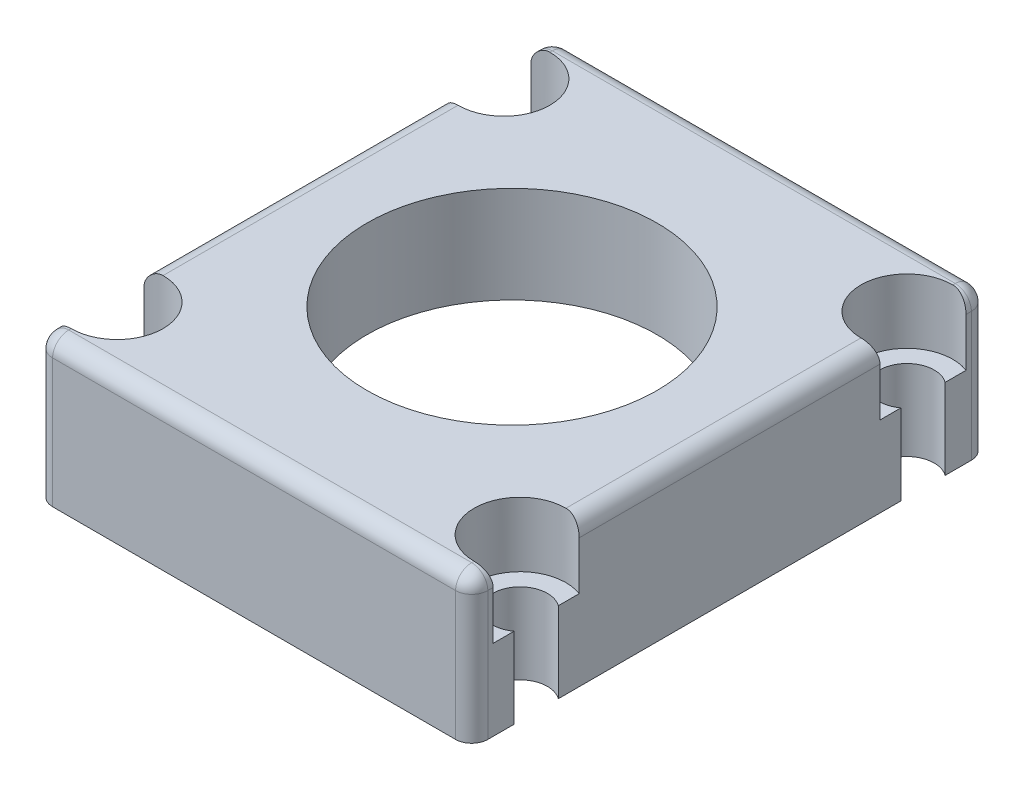
from build123d import *

# Parameters (mm, degrees)
SKETCH2_W               = 27
SKETCH2_H               = 32
SKETCH2_R               = 9
BOSS_EXTRUDE1_DEPTH     = 6
SKETCH3_W               = 27
SKETCH3_H               = 32
SKETCH3_W_2             = 25
SKETCH3_H_2             = 30
BOSS_EXTRUDE2_DEPTH     = 3
CUT_EXTRUDE1_DEPTH      = 22.77728174
CUT_EXTRUDE1_DEPTH_BACK = 22.77728174
SKETCH1_R               = 1.7
BOSS_EXTRUDE4_REACH     = 24.787
MIRROR2_COPY_1_REACH    = 24.787
SKETCH6_R               = 2.85
CUT_EXTRUDE2_DEPTH      = 4
MIRROR4_COPY_1_SKETCH_R = 2.85
MIRROR4_COPY_1_DEPTH    = 4
FILLET1_R               = 1
FILLET4_R               = 1


with BuildPart() as part:
    # Sketch2 → Boss-Extrude1 (new body)
    with BuildSketch(Plane(origin=(0, 0, 0), x_dir=(1, 0, 0), z_dir=(0, 1, 0))):
        Rectangle(SKETCH2_W, SKETCH2_H)
        with Locations(Location((0, 0, 0), (0, 0, 270))):
            Circle(SKETCH2_R, mode=Mode.SUBTRACT)
    extrude(amount=BOSS_EXTRUDE1_DEPTH)

    # Sketch3 → Boss-Extrude2 (add)
    with BuildSketch(Plane.XZ):
        Rectangle(SKETCH3_W, SKETCH3_H)
        Rectangle(SKETCH3_W_2, SKETCH3_H_2, mode=Mode.SUBTRACT)
    extrude(amount=BOSS_EXTRUDE2_DEPTH)

    # Sketch1 → Cut-Extrude1 (cut, two sides: drawn at the far end of the back side and taken through both)
    with BuildSketch(Plane(origin=(0, 0, 0), x_dir=(1, 0, 0), z_dir=(0, 1, 0)).offset(-CUT_EXTRUDE1_DEPTH_BACK)):
        with Locations((-12.5, 12)):
            Circle(SKETCH1_R)
        with Locations((12.5, 12)):
            Circle(SKETCH1_R)
        with Locations((-12.5, -12)):
            Circle(SKETCH1_R)
        with Locations((12.5, -12)):
            Circle(SKETCH1_R)
    extrude(amount=CUT_EXTRUDE1_DEPTH + CUT_EXTRUDE1_DEPTH_BACK, mode=Mode.SUBTRACT)

    # Sketch5 → Boss-Extrude4 (add, up to next)
    with BuildSketch(Plane.XZ.offset(3), mode=Mode.PRIVATE) as boss_extrude4_sk1:
        with BuildLine():
            Line((13.5, -10.625227292), (13.5, -9.708712153))
            ThreePointArc((13.5, -9.708712153), (10, -12), (13.5, -14.291287847))
            Line((13.5, -14.291287847), (13.5, -13.374772708))
            ThreePointArc((13.5, -13.374772708), (10.8, -12), (13.5, -10.625227292))
        make_face()
    boss_extrude4_tool1 = extrude(boss_extrude4_sk1.sketch, amount=-BOSS_EXTRUDE4_REACH, mode=Mode.PRIVATE) - part.part
    boss_extrude4 = boss_extrude4_tool1.solids().sort_by_distance((13.438967, -3, -10.16697))[0]
    add(boss_extrude4)

    # Mirror1: Boss-Extrude4 across plane
    add(boss_extrude4.mirror(Plane(origin=(0, 0, 0), x_dir=(0, 0, 1), z_dir=(1, 0, 0))))

    # Mirror2: Boss-Extrude4 across plane
    add(boss_extrude4.mirror(Plane.XY))

    # Mirror2 copy 1 sketch → Mirror2 copy 1 (add, up to next)
    with BuildSketch(Plane(origin=(0, -3, 0), x_dir=(-1, 0, 0), z_dir=(0, -1, 0)), mode=Mode.PRIVATE) as mirror2_copy_1_sk1:
        with BuildLine():
            Line((13.5, -10.625227292), (13.5, -9.708712153))
            ThreePointArc((13.5, -9.708712153), (10, -12), (13.5, -14.291287847))
            Line((13.5, -14.291287847), (13.5, -13.374772708))
            ThreePointArc((13.5, -13.374772708), (10.8, -12), (13.5, -10.625227292))
        make_face()
    mirror2_copy_1_tool1 = extrude(mirror2_copy_1_sk1.sketch, amount=-MIRROR2_COPY_1_REACH, mode=Mode.PRIVATE) - part.part
    add(mirror2_copy_1_tool1.solids().sort_by_distance((-13.438967, -3, 10.16697))[0])

    # Sketch6 → Cut-Extrude2 (cut)
    with BuildSketch(Plane(origin=(0, 6, 0), x_dir=(1, 0, 0), z_dir=(0, 1, 0))):
        with Locations((12.5, 12)):
            Circle(SKETCH6_R)
    cut_extrude2 = extrude(amount=-CUT_EXTRUDE2_DEPTH, mode=Mode.SUBTRACT)

    # Mirror3: Cut-Extrude2 across plane
    add(cut_extrude2.mirror(Plane(origin=(0, 0, 0), x_dir=(0, 0, 1), z_dir=(1, 0, 0))), mode=Mode.SUBTRACT)

    # Mirror4: Cut-Extrude2 across plane
    add(cut_extrude2.mirror(Plane.XY), mode=Mode.SUBTRACT)

    # Mirror4 copy 1 sketch → Mirror4 copy 1 (cut)
    with BuildSketch(Plane(origin=(0, 6, 0), x_dir=(-1, 0, 0), z_dir=(0, 1, 0))):
        with Locations((12.5, 12)):
            Circle(MIRROR4_COPY_1_SKETCH_R)
    extrude(amount=-MIRROR4_COPY_1_DEPTH, mode=Mode.SUBTRACT)

    # Fillet1
    fillet1_edges = [part.edges().sort_by_distance(p)[0] for p in [
        (-13.5, 6, -15.334400615),
        (13.5, 6, -15.334400615),
        (0, 6, 16),
        (-13.5, 6, 0),
        (13.5, 6, 0),
        (-13.5, 6, 15.334400615),
        (13.5, 6, 15.334400615),
        (0, 6, -16),
    ]]
    fillet(fillet1_edges, radius=FILLET1_R)

    # Fillet4
    # the kernel refuses this fillet: 1 mm, written as the material it takes off along each edge
    with BuildSketch(Plane(origin=(-12.5, 5, -15), x_dir=(0, 0, -1), z_dir=(-1, 0, 0))) as fillet4_piece_1_section:
        Polygon((0, 0), (FILLET4_R, 0), (FILLET4_R, -FILLET4_R), (0, -FILLET4_R), align=None)
    fillet4_piece_1 = extrude(amount=FILLET4_R, mode=Mode.PRIVATE)
    fillet4_piece_1 = fillet4_piece_1 - Plane(origin=(-12.5, 5, -15), x_dir=(0, -0.7071067811865475, 0.7071067811865475), z_dir=(-1, 0, 0)) * Sphere(FILLET4_R, mode=Mode.PRIVATE)
    add(fillet4_piece_1, mode=Mode.SUBTRACT)
    with BuildSketch(Plane(origin=(12.5, 5, -15), x_dir=(1, 0, 0), z_dir=(0, 0, -1))) as fillet4_piece_2_section:
        Polygon((0, 0), (FILLET4_R, 0), (FILLET4_R, -FILLET4_R), (0, -FILLET4_R), align=None)
    fillet4_piece_2 = extrude(amount=FILLET4_R, mode=Mode.PRIVATE)
    fillet4_piece_2 = fillet4_piece_2 - Plane(origin=(12.5, 5, -15), x_dir=(-0.7071067811865475, -0.7071067811865475, 0), z_dir=(0, 0, -1)) * Sphere(FILLET4_R, mode=Mode.PRIVATE)
    add(fillet4_piece_2, mode=Mode.SUBTRACT)
    with BuildSketch(Plane(origin=(-12.5, 5, 15), x_dir=(-1, 0, 0), z_dir=(0, 0, 1))) as fillet4_piece_3_section:
        Polygon((0, 0), (FILLET4_R, 0), (FILLET4_R, -FILLET4_R), (0, -FILLET4_R), align=None)
    fillet4_piece_3 = extrude(amount=FILLET4_R, mode=Mode.PRIVATE)
    fillet4_piece_3 = fillet4_piece_3 - Plane(origin=(-12.5, 5, 15), x_dir=(0.7071067811865475, -0.7071067811865475, 0), z_dir=(0, 0, 1)) * Sphere(FILLET4_R, mode=Mode.PRIVATE)
    add(fillet4_piece_3, mode=Mode.SUBTRACT)
    with BuildSketch(Plane(origin=(12.5, 5, 15), x_dir=(1, 0, 0), z_dir=(0, 0, 1))) as fillet4_piece_4_section:
        Polygon((0, 0), (FILLET4_R, 0), (FILLET4_R, FILLET4_R), (0, FILLET4_R), align=None)
    fillet4_piece_4 = extrude(amount=FILLET4_R, mode=Mode.PRIVATE)
    fillet4_piece_4 = fillet4_piece_4 - Plane(origin=(12.5, 5, 15), x_dir=(-0.7071067811865475, -0.7071067811865475, 0), z_dir=(0, 0, 1)) * Sphere(FILLET4_R, mode=Mode.PRIVATE)
    add(fillet4_piece_4, mode=Mode.SUBTRACT)
    with BuildSketch(Plane(origin=(13.5, -5.5, -16), x_dir=(-1, 0, 0), z_dir=(0, 1, 0))) as fillet4_piece_5:
        with BuildLine():
            CenterArc((FILLET4_R, FILLET4_R), FILLET4_R, 180, 90)
            Line((0, FILLET4_R), (0, 0))
            Line((0, 0), (FILLET4_R, 0))
        make_face()
    extrude(amount=10.5, mode=Mode.SUBTRACT)
    with BuildSketch(Plane(origin=(13.5, -5.5, 16), x_dir=(-1, 0, 0), z_dir=(0, 1, 0)), Plane(origin=(-13.5, 5, 16), x_dir=(1, 0, 0), z_dir=(0, -1, 0)), Plane(origin=(-13.5, 5, -16), x_dir=(0, 0, 1), z_dir=(0, -1, 0))) as fillet4_piece_6:
        with BuildLine():
            CenterArc((FILLET4_R, -FILLET4_R), FILLET4_R, 90, 90)
            Line((0, -FILLET4_R), (0, 0))
            Line((0, 0), (FILLET4_R, 0))
        make_face()
    extrude(amount=10.5, mode=Mode.SUBTRACT)


solid = part.part
